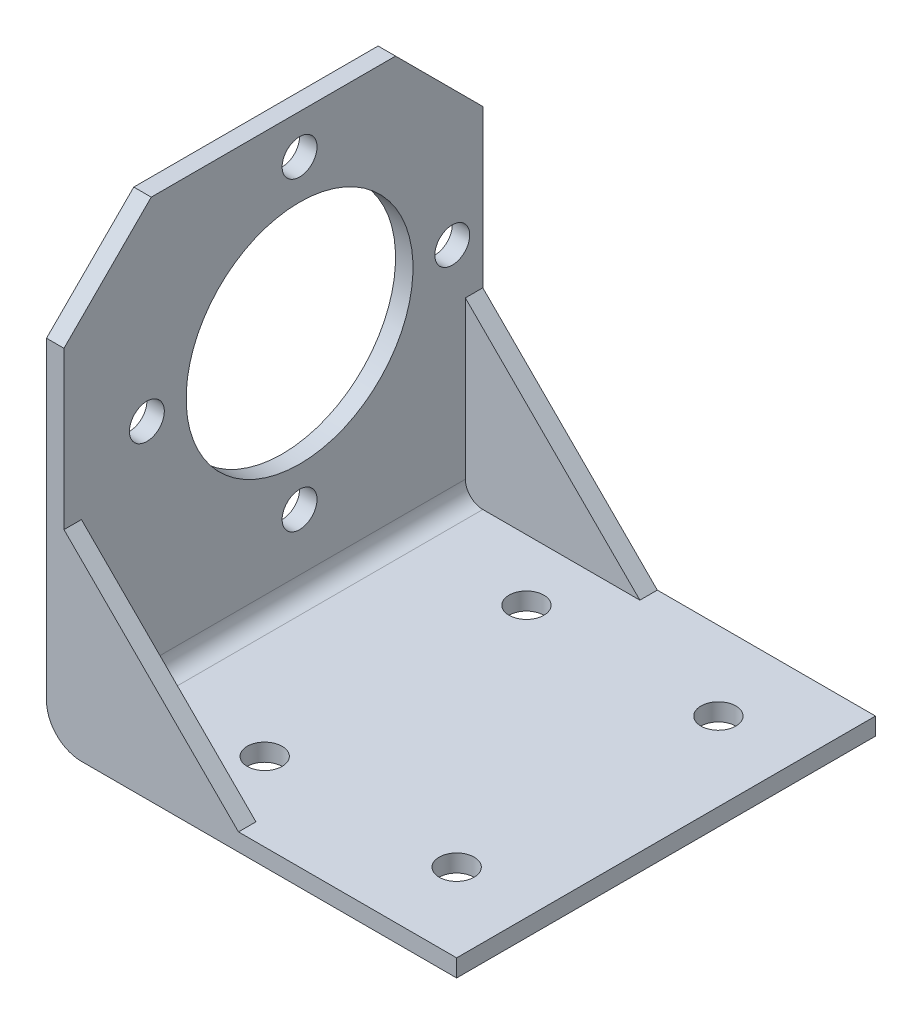
from build123d import *

# Parameters (mm, degrees)
SM_BASE_FLANGE_1_DEPTH = 48
SKETCH_6_R             = 2
CUT_EXTRUDE_1_DEPTH    = 10
SKETCH_7_R             = 13
SKETCH_7_R_2           = 2
CUT_EXTRUDE_2_DEPTH    = 10
CHAMFER_1_SIZE         = 10
EXTRUDE_START          = -2
EXTRUDE_1_DEPTH        = 2


# Sheet-metal steps are written as plain solids
with BuildPart() as part:
    # Sketch 1 → 基体-法兰1 (new body)
    with BuildSketch(Plane.XY):
        with BuildLine():
            Line((0, 50), (0, 4))
            ThreePointArc((0, 4), (1.171572875, 1.171572875), (4, 0))
            Line((4, 0), (47, 0))
            Line((47, 0), (47, 2))
            Line((47, 2), (4, 2))
            ThreePointArc((4, 2), (2.585786438, 2.585786438), (2, 4))
            Line((2, 4), (2, 50))
            Line((2, 50), (0, 50))
        make_face()
    extrude(amount=SM_BASE_FLANGE_1_DEPTH)

    # 草图6 → 切除-拉伸1 (cut)
    with BuildSketch(Plane(origin=(0, 2, 0), x_dir=(1, 0, 0), z_dir=(0, 1, 0))):
        with Locations(Location((38, -9, 0), (0, 0, 270))):
            Circle(SKETCH_6_R)
        with Locations(Location((38, -39, 0), (0, 0, 270))):
            Circle(SKETCH_6_R)
        with Locations(Location((16, -9, 0), (0, 0, 270))):
            Circle(SKETCH_6_R)
        with Locations(Location((16, -39, 0), (0, 0, 270))):
            Circle(SKETCH_6_R)
    extrude(amount=-CUT_EXTRUDE_1_DEPTH, mode=Mode.SUBTRACT)

    # 草图7 → 切除-拉伸2 (cut)
    with BuildSketch(Plane(origin=(2, 0, 0), x_dir=(0, 0, -1), z_dir=(1, 0, 0))):
        with Locations(Location((-21, 28, 0), (0, 0, 90))):
            Circle(SKETCH_7_R)
        with Locations(Location((-21, 45.5, 0), (0, 0, 90))):
            Circle(SKETCH_7_R_2)
        with Locations(Location((-3.5, 28, 0), (0, 0, 90))):
            Circle(SKETCH_7_R_2)
        with Locations(Location((-21, 10.5, 0), (0, 0, 90))):
            Circle(SKETCH_7_R_2)
        with Locations(Location((-38.5, 28, 0), (0, 0, 90))):
            Circle(SKETCH_7_R_2)
    extrude(amount=-CUT_EXTRUDE_2_DEPTH, mode=Mode.SUBTRACT)

    # 倒角1
    chamfer_1_edges = [part.edges().sort_by_distance(p)[0] for p in [
        (1, 50, 48),
        (1, 50, 0),
    ]]
    chamfer(chamfer_1_edges, length=CHAMFER_1_SIZE)

    # 草图8 → 凸台-拉伸1 (add)
    with BuildSketch(Plane.XY.offset(48).offset(EXTRUDE_START)):
        with BuildLine():
            Line((2, 22), (22, 2))
            Line((22, 2), (4, 2))
            ThreePointArc((4, 2), (2.585786438, 2.585786438), (2, 4))
            Line((2, 4), (2, 22))
        make_face()
    extrude_1 = extrude(amount=EXTRUDE_1_DEPTH)

    # 镜向1: 凸台-拉伸1 across plane
    add(extrude_1.mirror(Plane.XY.offset(24)))


solid = part.part
